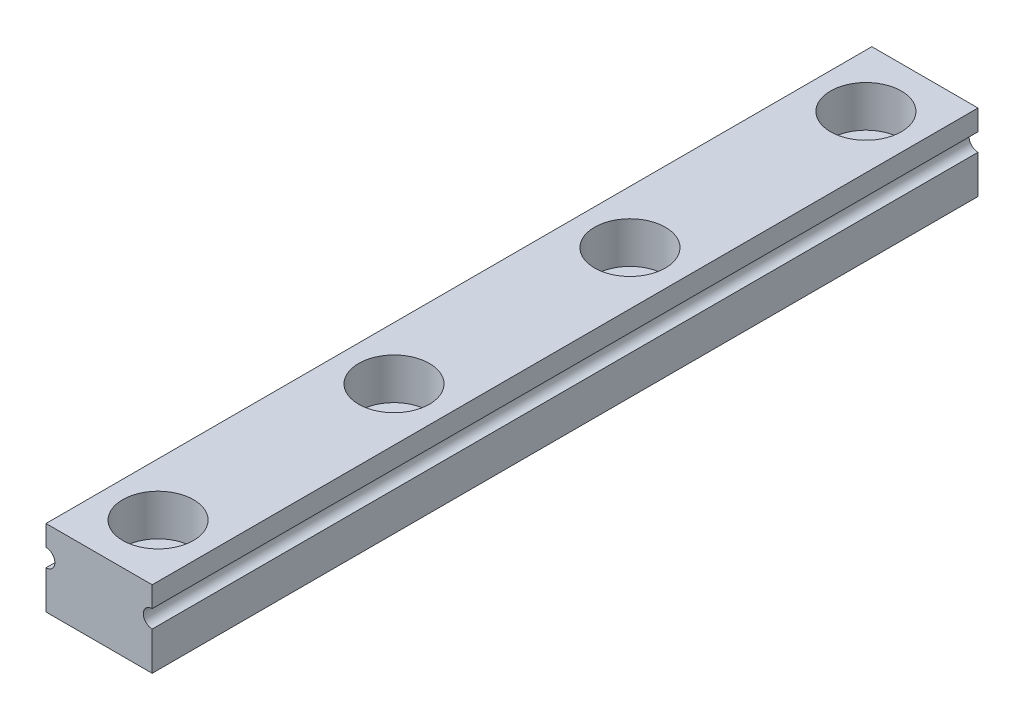
from build123d import *

# Parameters (mm, degrees)
SKETCH_1_W             = 9
SKETCH_1_H             = 6.5
EXTRUDE_1_DEPTH        = 70
SKETCH_3_R             = 0.75
CUT_EXTRUDE_2_DEPTH    = 71.874889771
SKETCH_2_R             = 3
CUT_EXTRUDE_1_DEPTH    = 3.5
SKETCH_4_R             = 1.65
CUT_EXTRUDE_3_DEPTH    = 71.874889771
PATTERN_LINEAR_1_COUNT = 7
PATTERN_LINEAR_1_PITCH = 20


with BuildPart() as part:
    # 草图1 → 凸台-拉伸1 (new body)
    with BuildSketch(Plane.XY):
        with Locations((4.5, 3.25)):
            Rectangle(SKETCH_1_W, SKETCH_1_H)
    extrude(amount=EXTRUDE_1_DEPTH)

    # 草图3 → 切除-拉伸2 (cut, through all)
    with BuildSketch(Plane(origin=(0, 0, 0), x_dir=(-1, 0, 0), z_dir=(0, 0, -1))):
        with Locations((-9, 4)):
            Circle(SKETCH_3_R)
        with Locations((0, 4)):
            Circle(SKETCH_3_R)
    extrude(amount=-CUT_EXTRUDE_2_DEPTH, mode=Mode.SUBTRACT)

    # 草图2 → 切除-拉伸1 (cut)
    with BuildSketch(Plane(origin=(0, 6.5, 0), x_dir=(1, 0, 0), z_dir=(0, 1, 0))):
        with Locations((4.5, -5)):
            Circle(SKETCH_2_R)
    cut_extrude_1 = extrude(amount=-CUT_EXTRUDE_1_DEPTH, mode=Mode.SUBTRACT)

    # 草图4 → 切除-拉伸3 (cut, through all)
    with BuildSketch(Plane(origin=(0, 6.5, 0), x_dir=(1, 0, 0), z_dir=(0, 1, 0))):
        with Locations((4.5, -5)):
            Circle(SKETCH_4_R)
    cut_extrude_3 = extrude(amount=-CUT_EXTRUDE_3_DEPTH, mode=Mode.SUBTRACT)

    # 阵列(线性)1: 切除-拉伸1, 切除-拉伸3 ×7
    with Locations(*[(0, 0, i * PATTERN_LINEAR_1_PITCH) for i in range(1, PATTERN_LINEAR_1_COUNT)]):
        add(cut_extrude_1, mode=Mode.SUBTRACT)
        add(cut_extrude_3, mode=Mode.SUBTRACT)


solid = part.part
